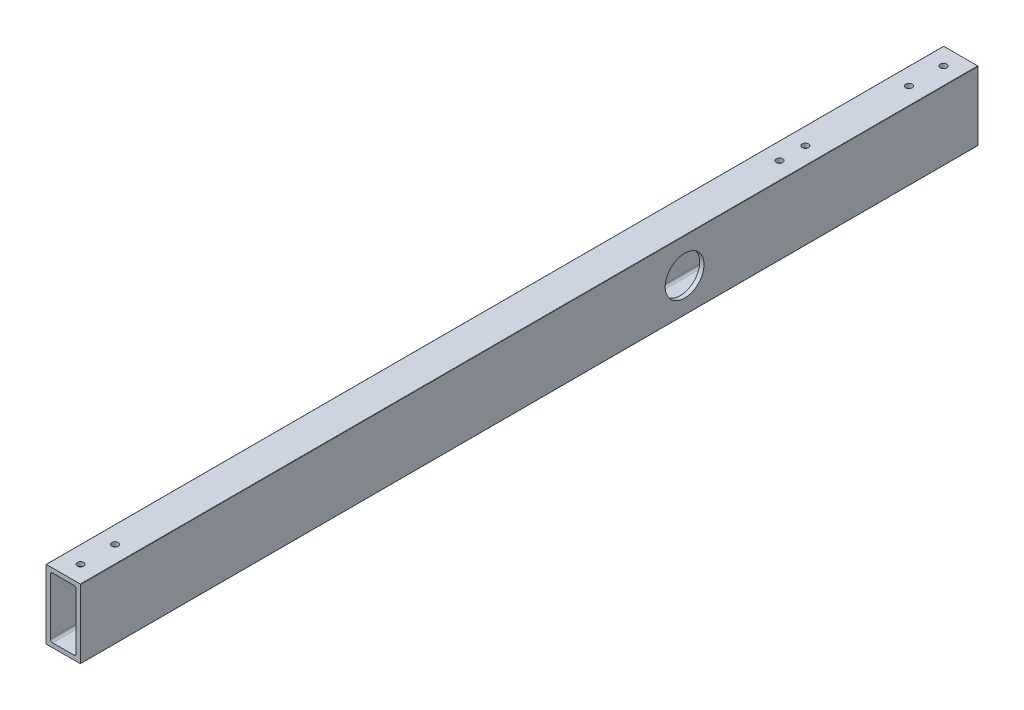
from build123d import *

# Parameters (mm, degrees)
BOSS_EXTRUDE1_DEPTH = 660.4
SKETCH2_R           = 2.38125
CUT_EXTRUDE1_DEPTH  = 663.837808216
SKETCH5_R           = 14.2875
CUT_EXTRUDE2_DEPTH  = 663.837808216


with BuildPart() as part:
    # Sketch1 → Boss-Extrude1 (new body)
    with BuildSketch(Plane(origin=(0, 0, 0), x_dir=(-1, 0, 0), z_dir=(0, 0, -1))):
        with BuildLine():
            Line((0, 0.254), (0, 50.546))
            ThreePointArc((0, 50.546), (-0.074394878, 50.725605122), (-0.254, 50.8))
            Line((-0.254, 50.8), (-25.146, 50.8))
            ThreePointArc((-25.146, 50.8), (-25.325605122, 50.725605122), (-25.4, 50.546))
            Line((-25.4, 50.546), (-25.4, 0.254))
            ThreePointArc((-25.4, 0.254), (-25.325605122, 0.074394878), (-25.146, 0))
            Line((-25.146, 0), (-0.254, 0))
            ThreePointArc((-0.254, 0), (-0.074394878, 0.074394878), (0, 0.254))
        make_face()
        with BuildLine():
            Line((-3.175, 46.0375), (-3.175, 4.7625))
            ThreePointArc((-3.175, 4.7625), (-3.639967985, 3.639967985), (-4.7625, 3.175))
            Line((-4.7625, 3.175), (-20.6375, 3.175))
            ThreePointArc((-20.6375, 3.175), (-21.760032015, 3.639967985), (-22.225, 4.7625))
            Line((-22.225, 4.7625), (-22.225, 46.0375))
            ThreePointArc((-22.225, 46.0375), (-21.760032015, 47.160032015), (-20.6375, 47.625))
            Line((-20.6375, 47.625), (-4.7625, 47.625))
            ThreePointArc((-4.7625, 47.625), (-3.639967985, 47.160032015), (-3.175, 46.0375))
        make_face(mode=Mode.SUBTRACT)
    extrude(amount=-BOSS_EXTRUDE1_DEPTH)

    # Sketch2 → Cut-Extrude1 (cut, through all)
    with BuildSketch(Plane(origin=(0, 50.8, 0), x_dir=(1, 0, 0), z_dir=(0, 1, 0))):
        with Locations((12.7, -647.7)):
            Circle(SKETCH2_R)
        with Locations((12.7, -622.3)):
            Circle(SKETCH2_R)
        with Locations((12.7, -38.1)):
            Circle(SKETCH2_R)
        with Locations((12.7, -12.7)):
            Circle(SKETCH2_R)
        with Locations((12.7, -133.35)):
            Circle(SKETCH2_R)
        with Locations((12.7, -114.3)):
            Circle(SKETCH2_R)
    extrude(amount=-CUT_EXTRUDE1_DEPTH, mode=Mode.SUBTRACT)

    # Sketch5 → Cut-Extrude2 (cut, through all)
    with BuildSketch(Plane(origin=(25.4, 0, 0), x_dir=(0, 0, -1), z_dir=(1, 0, 0))):
        with Locations((-215.9, 25.146)):
            Circle(SKETCH5_R)
    extrude(amount=-CUT_EXTRUDE2_DEPTH, mode=Mode.SUBTRACT)


solid = part.part
